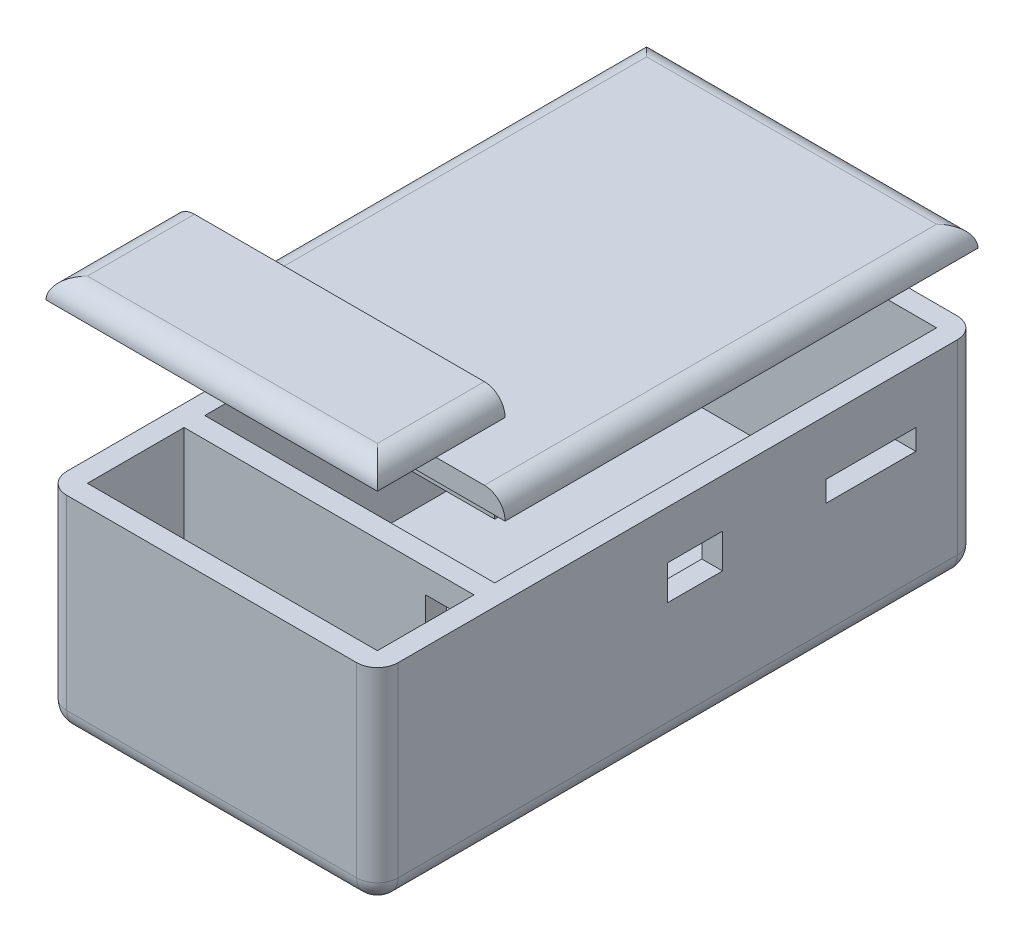
from build123d import *

# Parameters (mm, degrees)
SKETCH3_W           = 60.96
SKETCH3_H           = 110.49
BOSS_EXTRUDE2_DEPTH = 38.1
SKETCH1_W           = 53.34
SKETCH1_H           = 81.28
SKETCH1_H_2         = 17.78
CUT_EXTRUDE1_DEPTH  = 34.29
SKETCH4_W           = 8.89
SKETCH4_H           = 25.4
CUT_EXTRUDE2_DEPTH  = 3.81
SKETCH5_W           = 10.16
SKETCH5_H           = 6.35
SKETCH5_W_2         = 16.51
SKETCH5_H_2         = 3.81
CUT_EXTRUDE3_DEPTH  = 3.81
SKETCH6_W           = 12.192
SKETCH6_H           = 12.192
CUT_EXTRUDE4_DEPTH  = 3.81
SKETCH8_W           = 60.96
SKETCH8_H           = 86.995
BOSS_EXTRUDE3_DEPTH = 3.81
SKETCH9_W           = 60.96
SKETCH9_H           = 23.495
BOSS_EXTRUDE4_DEPTH = 3.81
SKETCH10_W          = 53.34
SKETCH10_H          = 81.28
BOSS_EXTRUDE5_DEPTH = 2.54
SKETCH11_W          = 53.34
SKETCH11_H          = 17.78
BOSS_EXTRUDE6_DEPTH = 2.54
FILLET1_R           = 3.81
FILLET2_R           = 3.81
FILLET3_R           = 3.81
SKETCH12_W          = 43.18
SKETCH12_H          = 71.12
CUT_EXTRUDE5_DEPTH  = 2.54


with BuildPart() as part:
    # Sketch3 → Boss-Extrude2 (new body)
    with BuildSketch(Plane(origin=(0, 0, 0), x_dir=(1, 0, 0), z_dir=(0, 1, 0))):
        with Locations((26.67, 29.845)):
            Rectangle(SKETCH3_W, SKETCH3_H)
    extrude(amount=-BOSS_EXTRUDE2_DEPTH)

    # Sketch1 → Cut-Extrude1 (cut)
    with BuildSketch(Plane(origin=(0, 0, 0), x_dir=(1, 0, 0), z_dir=(0, 1, 0))):
        with Locations((26.67, 40.64)):
            Rectangle(SKETCH1_W, SKETCH1_H)
        with Locations((26.67, -12.7)):
            Rectangle(SKETCH1_W, SKETCH1_H_2)
    extrude(amount=-CUT_EXTRUDE1_DEPTH, mode=Mode.SUBTRACT)

    # Sketch4 → Cut-Extrude2 (cut)
    with BuildSketch(Plane.XY.offset(3.81)):
        with Locations((48.895, -17.145)):
            Rectangle(SKETCH4_W, SKETCH4_H)
    extrude(amount=-CUT_EXTRUDE2_DEPTH, mode=Mode.SUBTRACT)

    # Sketch5 → Cut-Extrude3 (cut)
    with BuildSketch(Plane.ZY.offset(-53.34)):
        with Locations((-33.02, -12.065)):
            Rectangle(SKETCH5_W, SKETCH5_H)
        with Locations((-65.405, -12.065)):
            Rectangle(SKETCH5_W_2, SKETCH5_H_2)
    extrude(amount=-CUT_EXTRUDE3_DEPTH, mode=Mode.SUBTRACT)

    # Sketch6 → Cut-Extrude4 (cut)
    with BuildSketch(Plane(origin=(0, 0, 0), x_dir=(0, 0, -1), z_dir=(1, 0, 0))):
        with Locations((62.484, -17.145)):
            Rectangle(SKETCH6_W, SKETCH6_H)
    extrude(amount=-CUT_EXTRUDE4_DEPTH, mode=Mode.SUBTRACT)

    # Fillet1
    fillet1_edges = [part.edges().sort_by_distance(p)[0] for p in [
        (57.15, -38.1, -29.845),
        (26.67, -38.1, -85.09),
        (-3.81, -38.1, -29.845),
        (-3.81, -19.05, -85.09),
        (57.15, -19.05, -85.09),
        (57.15, -19.05, 25.4),
        (-3.81, -19.05, 25.4),
        (26.67, -38.1, 25.4),
    ]]
    fillet(fillet1_edges, radius=FILLET1_R)


with BuildPart() as body_2:
    # Sketch8 → Boss-Extrude3 (new body)
    with BuildSketch(Plane(origin=(0, 12.7, 0), x_dir=(1, 0, 0), z_dir=(0, 1, 0))):
        with Locations((26.67, 41.5925)):
            Rectangle(SKETCH8_W, SKETCH8_H)
    extrude(amount=BOSS_EXTRUDE3_DEPTH)

    # Sketch10 → Boss-Extrude5 (add)
    with BuildSketch(Plane.XZ.offset(-12.7)):
        with Locations((26.67, -40.64)):
            Rectangle(SKETCH10_W, SKETCH10_H)
    extrude(amount=BOSS_EXTRUDE5_DEPTH)

    # Fillet2
    fillet2_edges = [body_2.edges().sort_by_distance(p)[0] for p in [
        (57.15, 16.51, -41.5925),
        (26.67, 16.51, -85.09),
        (-3.81, 16.51, -41.5925),
    ]]
    fillet(fillet2_edges, radius=FILLET2_R - 0.0001)  # a hair under: the kernel refuses the full size

    # Sketch12 → Cut-Extrude5 (cut)
    with BuildSketch(Plane.XZ.offset(-10.16)):
        with Locations((26.67, -40.64)):
            Rectangle(SKETCH12_W, SKETCH12_H)
    extrude(amount=-CUT_EXTRUDE5_DEPTH, mode=Mode.SUBTRACT)


with BuildPart() as body_3:
    # Sketch9 → Boss-Extrude4 (new body)
    with BuildSketch(Plane(origin=(0, 29.21, 0), x_dir=(1, 0, 0), z_dir=(0, 1, 0))):
        with Locations((26.67, -13.6525)):
            Rectangle(SKETCH9_W, SKETCH9_H)
    extrude(amount=BOSS_EXTRUDE4_DEPTH)

    # Sketch11 → Boss-Extrude6 (add)
    with BuildSketch(Plane.XZ.offset(-29.21)):
        with Locations((26.67, 12.7)):
            Rectangle(SKETCH11_W, SKETCH11_H)
    extrude(amount=BOSS_EXTRUDE6_DEPTH)

    # Fillet3
    fillet3_edges = [body_3.edges().sort_by_distance(p)[0] for p in [
        (57.15, 33.02, 13.6525),
        (26.67, 33.02, 25.4),
        (-3.81, 33.02, 13.6525),
    ]]
    fillet(fillet3_edges, radius=FILLET3_R - 0.0001)  # a hair under: the kernel refuses the full size


solid = Compound([part.part, body_2.part, body_3.part])
